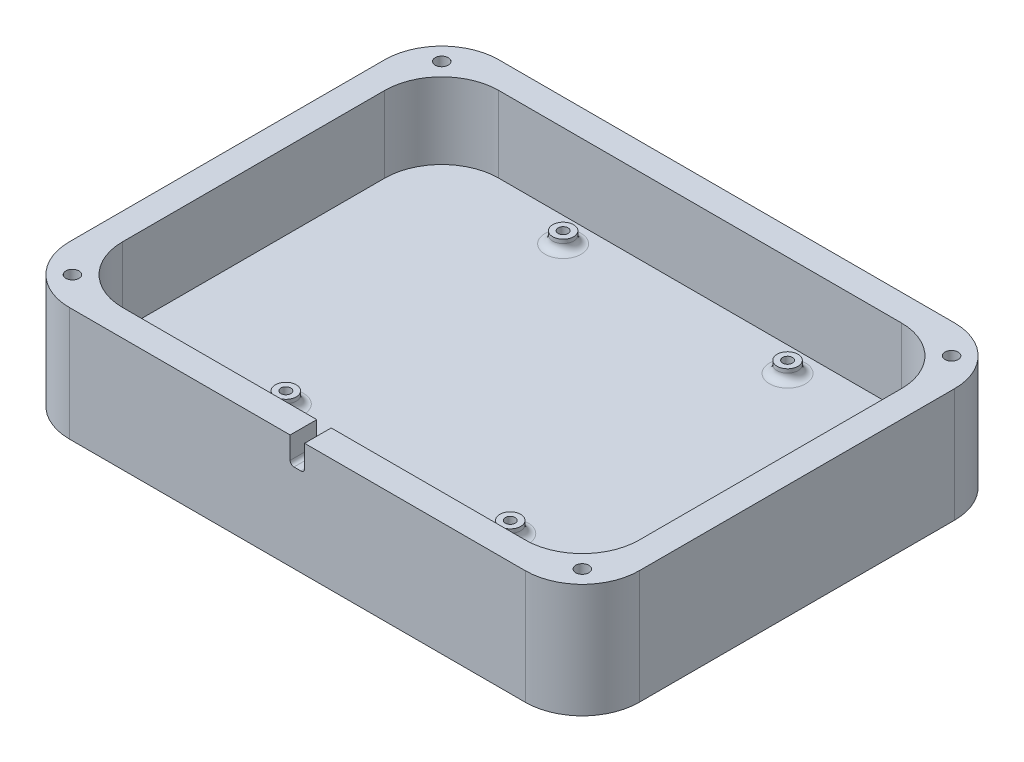
from build123d import *

# Parameters (mm, degrees)
SKETCH1_W                 = 150
SKETCH1_H                 = 100
BOSS_EXTRUDE1_DEPTH       = 10
SKETCH2_R                 = 2.75
BOSS_EXTRUDE2_DEPTH       = 3
F_1_0MM_DOWEL_HOLE1_D     = 2.6
F_1_0MM_DOWEL_HOLE1_DEPTH = 10
F_1_0MM_DOWEL_HOLE1_TIP   = 0.781118805
FILLET1_R                 = 2
SKETCH5_W                 = 150
SKETCH5_H                 = 13
BOSS_EXTRUDE3_DEPTH       = 10
SKETCH7_W                 = 150
SKETCH7_H                 = 113
SKETCH7_W_2               = 136
SKETCH7_H_2               = 99
EXTRUDE_THIN1_DEPTH       = 20
CUT_EXTRUDE1_REACH        = 140.903
FILLET2_R                 = 15
FILLET3_R                 = 15
SKETCH9_R                 = 1.725
CUT_EXTRUDE2_DEPTH        = 6


with BuildPart() as part:
    # Sketch1 → Boss-Extrude1 (new body)
    with BuildSketch(Plane(origin=(0, 0, 0), x_dir=(1, 0, 0), z_dir=(0, 1, 0))):
        Rectangle(SKETCH1_W, SKETCH1_H)
    extrude(amount=BOSS_EXTRUDE1_DEPTH)

    # Sketch2 → Boss-Extrude2 (add)
    with BuildSketch(Plane(origin=(0, 10, 0), x_dir=(1, 0, 0), z_dir=(0, 1, 0))):
        with Locations((29.54, 36.5)):
            Circle(SKETCH2_R)
        with Locations((29.54, -36.5)):
            Circle(SKETCH2_R)
        with Locations((-29.54, -36.5)):
            Circle(SKETCH2_R)
        with Locations((-29.54, 36.5)):
            Circle(SKETCH2_R)
    extrude(amount=BOSS_EXTRUDE2_DEPTH)

    # Ø1.0mm Dowel Hole1
    with Locations(Plane(origin=(0, 13, 0), x_dir=(1, 0, 0), z_dir=(0, 1, 0))):
        with Locations((-29.54, 36.5), (29.54, 36.5), (29.54, -36.5), (-29.54, -36.5)):
            Hole(F_1_0MM_DOWEL_HOLE1_D / 2, depth=F_1_0MM_DOWEL_HOLE1_DEPTH)
            with Locations((0, 0, -(F_1_0MM_DOWEL_HOLE1_DEPTH + F_1_0MM_DOWEL_HOLE1_TIP / 2))):  # 118° drill point
                Cone(0, F_1_0MM_DOWEL_HOLE1_D / 2, F_1_0MM_DOWEL_HOLE1_TIP, mode=Mode.SUBTRACT)

    # Fillet1
    fillet1_edges = [part.edges().sort_by_distance(p)[0] for p in [
        (26.79, 10, 36.5),
        (-32.29, 10, 36.5),
        (26.79, 10, -36.5),
        (-32.29, 10, -36.5),
    ]]
    fillet(fillet1_edges, radius=FILLET1_R)

    # Sketch5 → Boss-Extrude3 (add)
    with BuildSketch(Plane.XZ):
        with Locations((0, 56.5)):
            Rectangle(SKETCH5_W, SKETCH5_H)
    extrude(amount=-BOSS_EXTRUDE3_DEPTH)

    # Sketch7 → Extrude-Thin1 (add)
    with BuildSketch(Plane(origin=(0, 10, 0), x_dir=(1, 0, 0), z_dir=(0, 1, 0))):
        with Locations((0, -6.5)):
            Rectangle(SKETCH7_W, SKETCH7_H)
        with Locations((0, -6.5)):
            Rectangle(SKETCH7_W_2, SKETCH7_H_2, mode=Mode.SUBTRACT)
    extrude(amount=EXTRUDE_THIN1_DEPTH)

    # Sketch8 → Cut-Extrude1 (cut, up to next)
    with BuildSketch(Plane.XY.offset(63), mode=Mode.PRIVATE) as cut_extrude1_sk1:
        with BuildLine():
            Line((-1.9, 30), (1.9, 30))
            Line((1.9, 30), (1.9, 24.2))
            ThreePointArc((1.9, 24.2), (1.607106781, 23.492893219), (0.9, 23.2))
            Line((0.9, 23.2), (-0.9, 23.2))
            ThreePointArc((-0.9, 23.2), (-1.607106781, 23.492893219), (-1.9, 24.2))
            Line((-1.9, 24.2), (-1.9, 30))
        make_face()
    cut_extrude1_tool1 = extrude(cut_extrude1_sk1.sketch, amount=-CUT_EXTRUDE1_REACH, mode=Mode.PRIVATE) & part.part
    add(cut_extrude1_tool1.solids().sort_by_distance((0, 26.653655, 63))[0], mode=Mode.SUBTRACT)

    # Fillet2
    fillet2_edges = [part.edges().sort_by_distance(p)[0] for p in [
        (75, 15, 63),
        (75, 15, -50),
        (-75, 15, -50),
        (-75, 15, 63),
    ]]
    fillet(fillet2_edges, radius=FILLET2_R)

    # Fillet3
    fillet3_edges = [part.edges().sort_by_distance(p)[0] for p in [
        (-68, 20, -43),
        (-68, 20, 56),
        (68, 20, -43),
        (68, 20, 56),
    ]]
    fillet(fillet3_edges, radius=FILLET3_R)

    # Sketch9 → Cut-Extrude2 (cut)
    with BuildSketch(Plane(origin=(0, 30, 0), x_dir=(1, 0, 0), z_dir=(0, 1, 0))):
        with Locations((-67.106601718, 42.106601718)):
            Circle(SKETCH9_R)
        with Locations((67.106601718, 42.106601718)):
            Circle(SKETCH9_R)
        with Locations((67.106601718, -55.106601718)):
            Circle(SKETCH9_R)
        with Locations((-67.106601718, -55.106601718)):
            Circle(SKETCH9_R)
    extrude(amount=-CUT_EXTRUDE2_DEPTH, mode=Mode.SUBTRACT)


solid = part.part
